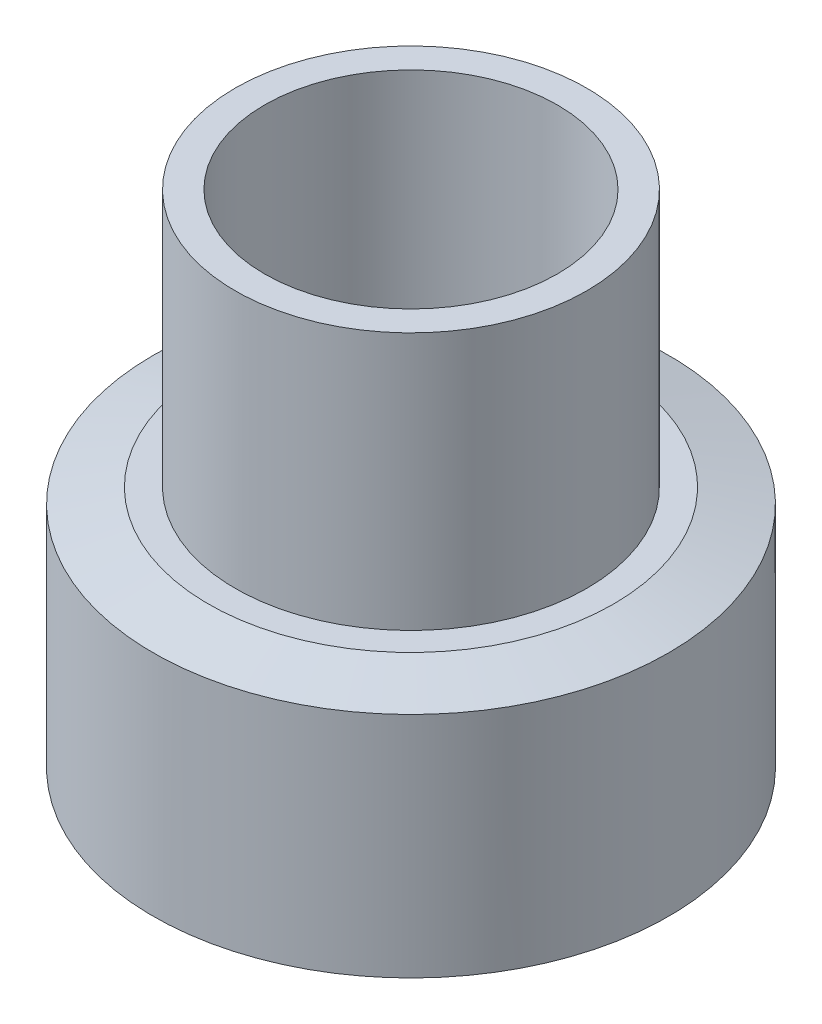
from build123d import *

# Parameters (mm, degrees)
CHAMFER_2_SIZE           = 0.94
CHAMFER_2_SIZE2          = 0.251872241
CHAMFER_3_SIZE           = 0.94
CHAMFER_3_SIZE2          = 0.251872241
CUT_EXTRUDE_2_DEPTH      = 11.777754868
CUT_EXTRUDE_2_DEPTH_BACK = 11.777754868
SKETCH_4_R               = 2.5


with BuildPart() as part:
    # Эскиз2 → Повернуть2 (revolve)
    with BuildSketch(Plane.XY):
        Polygon((0, 0), (4.4, 0), (4.4, 4.4), (3, 4.4), (3, 8.8), (0, 8.8), align=None)
    revolve(axis=Axis((0, 8.8, 0), (0, -1, 0)))

    # Фаска2
    chamfer_2_edges = [part.edges().sort_by_distance(p)[0] for p in [
        (-4.4, 4.4, 0),
    ]]
    chamfer_2_side = [part.faces().sort_by_distance(p)[0] for p in [
        (-4.275549207, 4.4, 0),
    ]]
    chamfer(chamfer_2_edges, length=CHAMFER_2_SIZE, length2=CHAMFER_2_SIZE2, reference=chamfer_2_side[0])

    # Фаска3
    chamfer_3_edges = [part.edges().sort_by_distance(p)[0] for p in [
        (-4.4, 0, 0),
    ]]
    chamfer_3_side = [part.faces().sort_by_distance(p)[0] for p in [
        (0, 0, 0),
    ]]
    chamfer(chamfer_3_edges, length=CHAMFER_3_SIZE, length2=CHAMFER_3_SIZE2, reference=chamfer_3_side[0])

    # Эскиз4 → Вырез-Вытянуть2 (cut, two sides: drawn at the far end of the back side and taken through both)
    with BuildSketch(Plane(origin=(0, 8.8, 0), x_dir=(1, 0, 0), z_dir=(0, 1, 0)).offset(-CUT_EXTRUDE_2_DEPTH_BACK)):
        Circle(SKETCH_4_R)
    extrude(amount=CUT_EXTRUDE_2_DEPTH + CUT_EXTRUDE_2_DEPTH_BACK, mode=Mode.SUBTRACT)


solid = part.part
